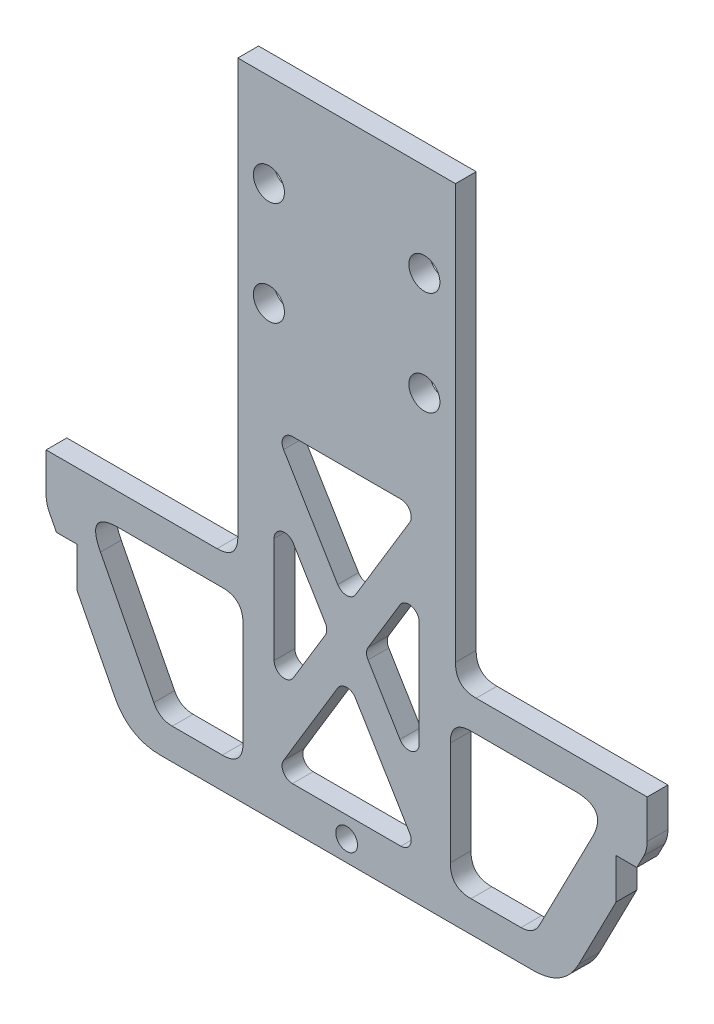
from build123d import *

# Parameters (mm, degrees)
SKETCH_1_R          = 1.5
EXTRUDE_1_DEPTH     = 2
FILLET_1_R          = 2
SKETCH_3_W          = 25.138692766
SKETCH_3_H          = 29.703861026
CUT_EXTRUDE_1_DEPTH = 38.286056375
SKETCH_4_W          = 21
SKETCH_4_H          = 34
SKETCH_4_W_2        = 14
SKETCH_4_H_2        = 29
EXTRUDE_2_DEPTH     = 2
EXTRUDE_3_DEPTH     = 2
FILLET_2_R          = 1
SKETCH_6_R          = 1.05
CUT_EXTRUDE_2_DEPTH = 50.175705384
EXTRUDE_4_DEPTH     = 2
SKETCH_8_W          = 18.5
SKETCH_8_H          = 2
EXTRUDE_5_DEPTH     = 3
SKETCH_9_W          = 15.5
SKETCH_9_H          = 11
EXTRUDE_6_DEPTH     = 2
CUT_EXTRUDE_3_DEPTH = 3
SKETCH_11_W         = 2
SKETCH_11_H         = 3.8875
CUT_EXTRUDE_4_DEPTH = 3
CUT_EXTRUDE_5_DEPTH = 3
FILLET_5_SIZE       = 2


with BuildPart() as part:
    # 草图1 → 凸台-拉伸1 (new body)
    with BuildSketch(Plane.XY):
        Polygon((-10.5, 14), (10.5, 14), (10.5, 4), (34.5, 4), (34.5, -4), (10.5, -4), (10.5, -14), (-10.5, -14), align=None)
        with Locations((-7.5, 5)):
            Circle(SKETCH_1_R, mode=Mode.SUBTRACT)
        with Locations((7.5, 5)):
            Circle(SKETCH_1_R, mode=Mode.SUBTRACT)
        with Locations((-7.5, -5)):
            Circle(SKETCH_1_R, mode=Mode.SUBTRACT)
        with Locations((7.5, -5)):
            Circle(SKETCH_1_R, mode=Mode.SUBTRACT)
        with Locations((16.5, 0)):
            Circle(SKETCH_1_R, mode=Mode.SUBTRACT)
        with Locations((31.5, 0)):
            Circle(SKETCH_1_R, mode=Mode.SUBTRACT)
    extrude(amount=EXTRUDE_1_DEPTH)

    # 圆角1
    fillet_1_edges = [part.edges().sort_by_distance(p)[0] for p in [
        (10.5, 4, 1),
        (10.5, -4, 1),
    ]]
    fillet(fillet_1_edges, radius=FILLET_1_R)

    # 草图3 → 切除-拉伸1 (cut, through all)
    with BuildSketch(Plane.XY.offset(2)):
        with Locations((23.069346383, -0.851930513)):
            Rectangle(SKETCH_3_W, SKETCH_3_H)
    extrude(amount=-CUT_EXTRUDE_1_DEPTH, mode=Mode.SUBTRACT)

    # 草图4 → 凸台-拉伸2 (add)
    with BuildSketch(Plane.XY.offset(2)):
        with Locations((0, -31)):
            Rectangle(SKETCH_4_W, SKETCH_4_H)
        with Locations((0, -29.5)):
            Rectangle(SKETCH_4_W_2, SKETCH_4_H_2, mode=Mode.SUBTRACT)
    extrude(amount=-EXTRUDE_2_DEPTH)

    # 草图5 → 凸台-拉伸3 (add)
    with BuildSketch(Plane.XY.offset(2)):
        Polygon((-7, -15), (0, -26.597266199), (7, -15), (7, -20.805467602), (1.75206262, -29.5), (7, -38.194532398), (7, -44), (0, -32.402733801), (-7, -44), (-7, -38.194532398), (-1.75206262, -29.5), (-7, -20.805467602), align=None)
    extrude(amount=-EXTRUDE_3_DEPTH)

    # 圆角2
    fillet_2_edges = [part.edges().sort_by_distance(p)[0] for p in [
        (-7, -20.805467602, 1),
        (0, -26.597266199, 1),
        (7, -20.805467602, 1),
        (1.75206262, -29.5, 1),
        (7, -38.194532398, 1),
        (0, -32.402733801, 1),
        (-7, -38.194532398, 1),
        (-1.75206262, -29.5, 1),
        (-7, -44, 1),
        (7, -44, 1),
        (7, -15, 1),
        (-7, -15, 1),
    ]]
    fillet(fillet_2_edges, radius=FILLET_2_R)

    # 草图6 → 切除-拉伸2 (cut, through all)
    with BuildSketch(Plane.XY.offset(2)):
        with Locations((0, -46)):
            Circle(SKETCH_6_R)
    extrude(amount=-CUT_EXTRUDE_2_DEPTH, mode=Mode.SUBTRACT)

    # 草图7 → 凸台-拉伸4 (add)
    with BuildSketch(Plane.XY.offset(2)):
        Polygon((10.5, -31), (29, -31), (29, -48), (10.5, -48), (10.5, -45), (26, -45), (26, -34), (10.5, -34), align=None)
        Polygon((-10.5, -31), (-29, -31), (-29, -48), (-10.5, -48), (-10.5, -45), (-26, -45), (-26, -34), (-10.5, -34), align=None)
    extrude(amount=-EXTRUDE_4_DEPTH)

    # 草图8 → 凸台-拉伸5 (add)
    with BuildSketch(Plane(origin=(0, -31, 0), x_dir=(1, 0, 0), z_dir=(0, 1, 0))):
        with Locations((19.75, -1)):
            Rectangle(SKETCH_8_W, SKETCH_8_H)
        with Locations((-19.75, -1)):
            Rectangle(SKETCH_8_W, SKETCH_8_H)
    extrude(amount=EXTRUDE_5_DEPTH)

    # 草图9 → 凸台-拉伸6 (add)
    with BuildSketch(Plane.XY.offset(2)):
        with Locations((-18.25, -39.5)):
            Rectangle(SKETCH_9_W, SKETCH_9_H)
        with Locations((18.25, -39.5)):
            Rectangle(SKETCH_9_W, SKETCH_9_H)
    extrude(amount=-EXTRUDE_6_DEPTH)

    # 草图10 → 切除-拉伸3 (cut)
    with BuildSketch(Plane.XY.offset(2)):
        Polygon((-29, -32.45), (-21, -48), (-29, -48), align=None)
        Polygon((29, -32.45), (21, -48), (29, -48), align=None)
    extrude(amount=-CUT_EXTRUDE_3_DEPTH, mode=Mode.SUBTRACT)

    # 圆角3
    # a fillet whose section is not a circle: 5 mm, written as the material it takes off along each edge
    with BuildSketch(Plane(origin=(21, -48, 9.626374286), x_dir=(-1, 0, 0), z_dir=(0, 0, -1)), Plane(origin=(-21, -48, 9.626374286), x_dir=(-0.4574772177885783, 0.8892213420765506, 0), z_dir=(0, 0, -1))) as fillet_3_piece_1:
        with BuildLine():
            Bezier((3.050549714, 0), (0, 0), (-1.395556996, 2.712613911), weights=[1, 1, 1])
            Line((-1.395556996, 2.712613911), (0, 0))
            Line((0, 0), (3.050549714, 0))
        make_face()
    extrude(amount=17.252748572, mode=Mode.SUBTRACT)

    # 圆角4
    # a fillet whose section is not a circle: 3 mm, written as the material it takes off along each edge
    with BuildSketch(Plane(origin=(29, -32.45, 3.816134011), x_dir=(-0.45747721778857864, -0.8892213420765502, 0), z_dir=(0, 0, -1)), Plane(origin=(-29, -32.45, 3.816134011), x_dir=(0, 1, 0), z_dir=(0, 0, -1))) as fillet_4_piece_1:
        with BuildLine():
            Bezier((0.726453604, 0), (0, 0), (-0.645978049, 0.332335974), weights=[1, 1, 1])
            Line((-0.645978049, 0.332335974), (0, 0))
            Line((0, 0), (0.726453604, 0))
        make_face()
    extrude(amount=5.632268022, mode=Mode.SUBTRACT)

    # 草图11 → 切除-拉伸4 (cut)
    with BuildSketch(Plane.XY.offset(2)):
        with Locations((-27, -36.3375)):
            Rectangle(SKETCH_11_W, SKETCH_11_H)
        with Locations((27, -36.3375)):
            Rectangle(SKETCH_11_W, SKETCH_11_H)
    extrude(amount=-CUT_EXTRUDE_4_DEPTH, mode=Mode.SUBTRACT)

    # 草图12 → 切除-拉伸5 (cut)
    with BuildSketch(Plane.XY.offset(2)):
        Polygon((-25.247663122, -31), (-18.045090775, -45), (-10, -45), (-10, -31), align=None)
        Polygon((25.247663122, -31), (10, -31), (10, -45), (18.045090775, -45), align=None)
    extrude(amount=-CUT_EXTRUDE_5_DEPTH, mode=Mode.SUBTRACT)

    # 圆角5
    # a fillet whose section is not a circle: 2 mm, written as the material it adds along each edge
    with BuildSketch(Plane(origin=(10.5, -28, 0), x_dir=(0, 1, 0), z_dir=(0, 0, 1)), Plane(origin=(10, -45, 2), x_dir=(1, 0, 0), z_dir=(0, 0, -1)), Plane(origin=(10, -31, 2), x_dir=(0, -1, 0), z_dir=(0, 0, -1)), Plane(origin=(-10.5, -28, 2), x_dir=(0, 1, 0), z_dir=(0, 0, -1)), Plane(origin=(-10, -45, 2), x_dir=(0, 1, 0), z_dir=(0, 0, -1)), Plane(origin=(-10, -31, 2), x_dir=(-1, 0, 0), z_dir=(0, 0, -1))) as fillet_5_piece_1:
        with BuildLine():
            Bezier((FILLET_5_SIZE, 0), (0, 0), (0, -FILLET_5_SIZE), weights=[1, 1, 1])
            Line((0, -FILLET_5_SIZE), (0, 0))
            Line((0, 0), (FILLET_5_SIZE, 0))
        make_face()
    extrude(amount=2)
    with BuildSketch(Plane(origin=(25.247663122, -31, 2), x_dir=(-0.45747721778857914, -0.8892213420765501, 0), z_dir=(0, 0, -1)), Plane(origin=(-25.247663122, -31, 2), x_dir=(1, 0, 0), z_dir=(0, 0, -1))) as fillet_5_piece_2:
        with BuildLine():
            Bezier((3.278097699, 0), (0, 0), (1.499655015, 2.914954436), weights=[1, 1, 1])
            Line((1.499655015, 2.914954436), (0, 0))
            Line((0, 0), (3.278097699, 0))
        make_face()
    extrude(amount=2)
    with BuildSketch(Plane(origin=(18.045090775, -45, 2), x_dir=(0.45747721778857875, 0.8892213420765502, 0), z_dir=(0, 0, -1)), Plane(origin=(-18.045090775, -45, 2), x_dir=(1, 0, 0), z_dir=(0, 0, -1))) as fillet_5_piece_3:
        with BuildLine():
            Bezier((1.220219886, 0), (0, 0), (-0.558222798, -1.085045564), weights=[1, 1, 1])
            Line((-0.558222798, -1.085045564), (0, 0))
            Line((0, 0), (1.220219886, 0))
        make_face()
    extrude(amount=2)


solid = part.part
